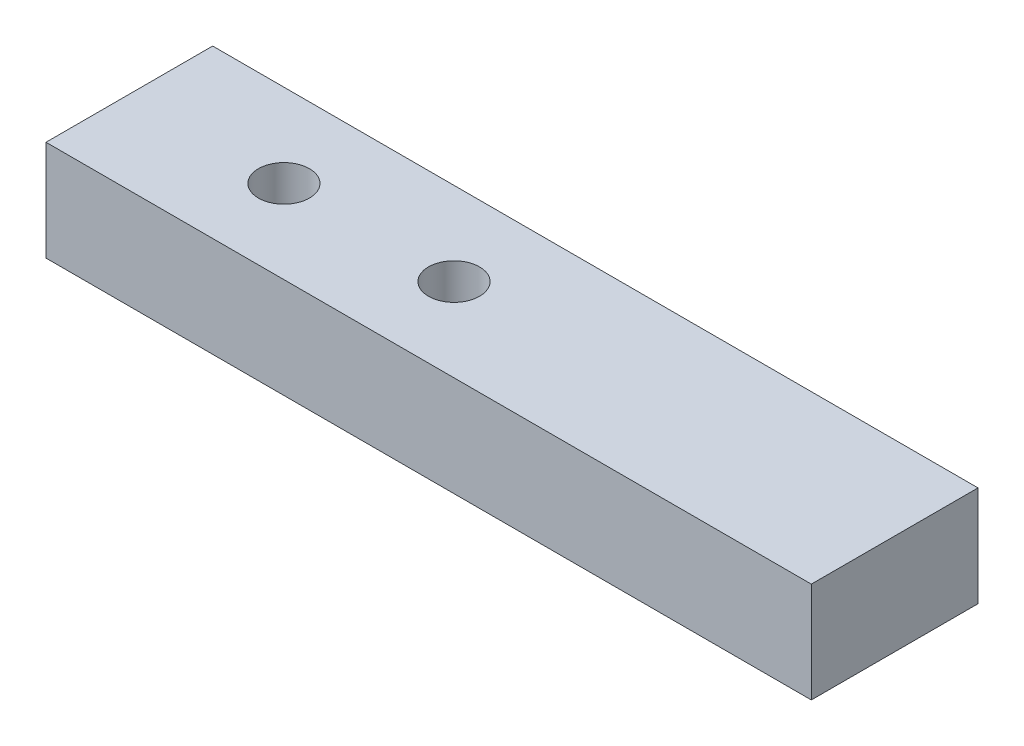
from build123d import *

# Parameters (mm, degrees)
SKETCH1_W           = 45
SKETCH1_H           = 9.8
SKETCH1_R           = 1.5
BOSS_EXTRUDE1_DEPTH = 5.9


with BuildPart() as part:
    # Sketch1 → Boss-Extrude1 (new body)
    with BuildSketch(Plane(origin=(0, 0, 0), x_dir=(1, 0, 0), z_dir=(0, 1, 0))):
        Rectangle(SKETCH1_W, SKETCH1_H)
        with Locations((-13.41, 0)):
            Circle(SKETCH1_R, mode=Mode.SUBTRACT)
        with Locations((-3.41, 0)):
            Circle(SKETCH1_R, mode=Mode.SUBTRACT)
    extrude(amount=BOSS_EXTRUDE1_DEPTH)


solid = part.part
